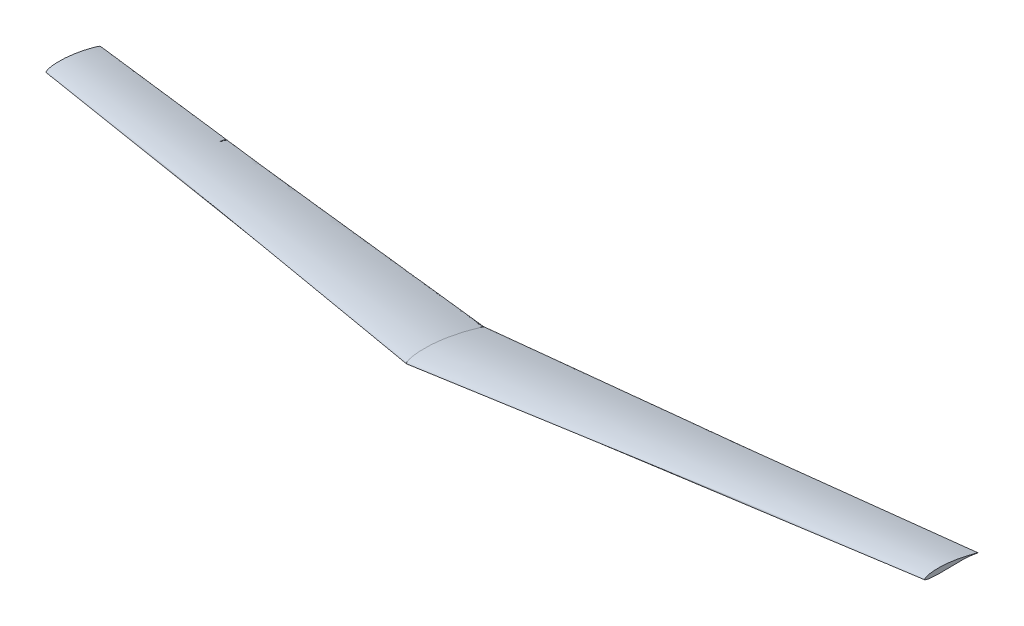
from build123d import *


with BuildPart() as part:
    # Loft3: read off the stored shape, not the designer's step
    # Loft3: loft between two sections, ruled curve by curve
    loft3_from = [
        Edge.make_bspline([(0, 75.247164627, -464.331540038), (0, 75.6060312, -457.82834533), (0, 76.2512327, -445.202547271), (0, 77.185146332, -423.396453137), (0, 77.851852326, -402.823951314), (0, 78.384441428, -378.735341731), (0, 78.599804642, -359.528542379), (0, 78.608574869, -335.434014553), (0, 78.410885776, -317.775299745), (0, 77.848540939, -293.687374761), (0, 77.266621088, -277.74828718), (0, 76.083715702, -253.682669347), (0, 75.204310786, -239.622607867), (0, 73.409020466, -216.252631889), (0, 72.250488825, -203.560310534), (0, 69.894800386, -181.715370443), (0, 68.344793791, -169.077547252), (0, 65.563444266, -149.514482666), (0, 63.445869974, -136.193461261), (0, 60.458195228, -119.791467615), (0, 57.611870491, -105.788986828), (0, 54.559453297, -92.688781018), (0, 50.729350644, -78.07194621), (0, 47.805028256, -68.371996538), (0, 43.285925655, -55.396852793), (0, 39.989169381, -47.024598313), (0, 34.755060544, -36.120807184), (0, 29.763527307, -27.033289804), (0, 25.107576593, -20.212379723), (0, 19.593769028, -13.324429015), (0, 14.717428586, -7.978729509), (0, 8.989414294, -3.614235784), (0, 4.171073763, -1.003554796), (0, 0.187452705, 0.593331348), (0, -6.337462482, -0.688665746), (0, -9.3007413, -3.958956156), (0, -12.304589132, -8.148470763), (0, -15.011270114, -13.317568851), (0, -17.604262314, -19.419368117), (0, -20.402400466, -26.642998258), (0, -22.363786989, -32.198636636), (0, -24.818935213, -39.617694728), (0, -26.916002004, -46.256885049), (0, -28.625001833, -52.042910185), (0, -30.111119868, -57.248917562), (0, -31.26278527, -61.394839145), (0, -32.884056502, -67.503030242), (0, -33.972501406, -71.786064636), (0, -35.195531482, -76.729555832), (0, -36.791182642, -83.384705035), (0, -38.493788216, -90.985953223), (0, -40.322368465, -99.597744987), (0, -42.307210197, -109.430836061), (0, -44.03457841, -118.724344416), (0, -46.262898048, -131.27758197), (0, -47.835614034, -140.702287296), (0, -50.091719165, -155.169756997), (0, -51.880886195, -167.372916857), (0, -53.845057805, -181.779612589), (0, -55.860851943, -197.387469346), (0, -57.492587754, -210.98804695), (0, -59.6109912, -229.861232229), (0, -60.933432411, -242.695021315), (0, -63.007230447, -264.184341873), (0, -64.126383253, -276.780169982), (0, -66.000951687, -299.839134327), (0, -67.012774981, -313.591861628), (0, -68.591693682, -337.634312849), (0, -69.507825803, -353.356173568), (0, -70.722564952, -377.419723199), (0, -71.478645865, -394.951250589), (0, -72.337971873, -419.030156153), (0, -72.889121706, -438.200134272), (0, -73.413599827, -462.288601341), (0, -73.728537136, -482.913185263), (0, -73.965299975, -507.006183041), (0, -74.085614533, -528.896025913), (0, -74.120515145, -552.989997208), (0, -74.05495843, -584.047648937), (0, -73.842966104, -616.256557677), (0, -73.414792031, -664.172023615), (0, -72.978245239, -705.064261293), (0, -72.439049051, -761.934735513), (0, -72.139858031, -803.384892477), (0, -72.011678844, -860.244680129), (0, -72.16207099, -901.093558595), (0, -72.848870113, -957.359853077), (0, -73.69482498, -996.457270019), (0, -75.502741586, -1051.546305771), (0, -77.119683908, -1087.795144307), (0, -80.219293997, -1141.149197232), (0, -82.553183427, -1173.512082095), (0, -87.014903347, -1224.616146322), (0, -89.848587872, -1252.180092773), (0, -95.264248106, -1297.996900966), (0, -98.478223443, -1322.318052233), (0, -104.418092524, -1361.841651034), (0, -108.335183761, -1385.753165153), (0, -113.585096912, -1414.986169203), (0, -118.176015732, -1438.625999881), (0, -122.595644632, -1459.021103053), (0, -125.8465154, -1473.886541251), (0, -127.377882012, -1480.859568216), (0, -131.642925945, -1497.670698678), (0, -128.527124068, -1486.734344721), (0, -125.812540371, -1477.386922633), (0, -122.805841688, -1467.281570547), (0, -118.71035201, -1453.210770692), (0, -114.811720143, -1439.757708319), (0, -112.34306017, -1431.253079279), (0, -110.405742131, -1424.583880294), (0, -107.378888486, -1414.167008781), (0, -104.620873392, -1404.672953379), (0, -99.890645793, -1388.348713749), (0, -94.385205618, -1369.272603864), (0, -87.718422183, -1345.970793561), (0, -79.209085893, -1315.975072113), (0, -72.735292135, -1292.819303198), (0, -62.017635352, -1253.836788849), (0, -55.530082507, -1229.702894441), (0, -43.636185572, -1184.295710226), (0, -36.627451615, -1156.744451925), (0, -24.339995571, -1106.586869976), (0, -16.755325965, -1074.373292423), (0, -4.971262664, -1021.950221986), (0, 2.719821527, -986.022006307), (0, 13.710480053, -931.830807409), (0, 21.114463837, -893.187912419), (0, 31.061196595, -837.73988643), (0, 37.793594993, -797.426206509), (0, 46.455045837, -741.26898439), (0, 52.239663992, -700.369066294), (0, 59.416683555, -644.05602025), (0, 63.985689249, -603.647055736), (0, 68.598073201, -556.130856178), (0, 71.310352704, -524.161275317), (0, 73.513229465, -493.271344733), (0, 74.605515967, -475.723985212), (0, 75.122179245, -466.596460587), (0, 75.247164627, -464.331540038)], [0, 0, 0, 0, 0.006406501, 0.01243527, 0.021468756, 0.026652485, 0.03613527, 0.040361874, 0.050352485, 0.053505235, 0.064061874, 0.06604018, 0.077205235, 0.077917643, 0.089095112, 0.08974018, 0.099529135, 0.101617643, 0.109175798, 0.112795112, 0.118014982, 0.123229135, 0.12602318, 0.132875798, 0.133187129, 0.139534913, 0.141714982, 0.145072765, 0.14972318, 0.149819578, 0.153737389, 0.15680172, 0.156887129, 0.159062281, 0.160899972, 0.163017729, 0.163234913, 0.165909021, 0.168772765, 0.169749183, 0.173519578, 0.174568397, 0.177437389, 0.180367786, 0.18050172, 0.182762281, 0.184599972, 0.186717729, 0.187108947, 0.189609021, 0.193449183, 0.194770427, 0.198268397, 0.203316152, 0.204067786, 0.210808947, 0.212714396, 0.218470427, 0.222940585, 0.227016152, 0.233950255, 0.236414396, 0.245697187, 0.246640585, 0.257650255, 0.258135474, 0.269397187, 0.271214202, 0.281835474, 0.284887791, 0.294914202, 0.299095999, 0.308587791, 0.31377818, 0.322795999, 0.328877354, 0.33747818, 0.344328147, 0.352577354, 0.368028147, 0.376010905, 0.399710905, 0.408254187, 0.431954187, 0.440484185, 0.464184185, 0.472134233, 0.495834233, 0.502649866, 0.526349866, 0.531521279, 0.555221279, 0.558268398, 0.581968398, 0.582455074, 0.603690459, 0.606155074, 0.621608427, 0.627390459, 0.635910174, 0.645308427, 0.646329529, 0.652670113, 0.6548, 0.656948054, 0.659610174, 0.663349751, 0.670029529, 0.673893203, 0.676370113, 0.6785, 0.680648054, 0.687049751, 0.688401904, 0.697593203, 0.706611667, 0.712101904, 0.728203086, 0.730311667, 0.751903086, 0.752769443, 0.776469443, 0.779869858, 0.803569858, 0.809020145, 0.832720145, 0.839709694, 0.863409694, 0.871420256, 0.895120256, 0.903610746, 0.927310746, 0.935748927, 0.959448927, 0.967307484, 0.982706501, 0.991007484, 0.997768756, 1, 1, 1, 1], 3),
    ]
    loft3_to = [
        Edge.make_bspline([(8492.832911869, -78.637931226, -1896.423668427), (8492.85012453, -78.337499617, -1891.917993478), (8492.883532504, -77.785067643, -1883.170266356), (8492.941198414, -76.937875392, -1868.061402132), (8492.995563108, -76.265679579, -1853.806412397), (8493.059176923, -75.627187523, -1837.113252347), (8493.109863102, -75.244771189, -1823.801434398), (8493.173406208, -74.923236896, -1807.09916141), (8493.21994434, -74.810501537, -1794.855897682), (8493.283389216, -74.819767162, -1778.150546507), (8493.325345648, -74.940943962, -1767.093144076), (8493.388662343, -75.294228288, -1750.391444414), (8493.425634499, -75.60792779, -1740.629519125), (8493.487062211, -76.314904494, -1724.394229982), (8493.520410083, -76.800308271, -1715.571528116), (8493.577799235, -77.819227556, -1700.372268646), (8493.610997989, -78.502979914, -1691.571475358), (8493.662396733, -79.754441715, -1677.929098828), (8493.69740518, -80.717097108, -1668.62742678), (8493.740546849, -82.077539842, -1657.149538892), (8493.777425312, -83.364045854, -1647.327172705), (8493.812013512, -84.719651468, -1638.101769545), (8493.850748153, -86.37653277, -1627.758282926), (8493.876592518, -87.602444815, -1620.846410033), (8493.911518506, -89.401030693, -1611.493314253), (8493.934278864, -90.660818051, -1605.390472432), (8493.964674223, -92.532350454, -1597.223874008), (8493.990601134, -94.242009526, -1590.247944949), (8494.011042058, -95.742389653, -1584.734742977), (8494.032747075, -97.452193951, -1578.870392987), (8494.050375213, -98.922612131, -1574.100397135), (8494.067710796, -100.556769631, -1569.393103163), (8494.080659164, -101.854574555, -1565.870355836), (8494.090562124, -102.890353394, -1563.172364784), (8494.105171066, -104.550106825, -1559.180734828), (8494.114954847, -105.760730674, -1556.498825975), (8494.126568956, -107.277063907, -1553.308259578), (8494.139723946, -109.109728474, -1549.684316212), (8494.154064465, -111.411892298, -1545.707156227), (8494.170250788, -114.313305802, -1541.191583012), (8494.181985112, -116.731879372, -1537.890429311), (8494.1964539, -120.272185221, -1533.771173748), (8494.208353383, -123.686789968, -1530.339393598), (8494.21671551, -127.052833513, -1527.843220404), (8494.222394184, -130.399175174, -1526.055302819), (8494.225747913, -133.264710698, -1524.921590173), (8494.220519533, -137.836213696, -1525.898227154), (8494.210717901, -139.937258133, -1528.295102892), (8494.198840443, -141.942988477, -1531.246866078), (8494.182060525, -144.057994724, -1535.479848449), (8494.162248016, -146.021915795, -1540.524506461), (8494.139696845, -148.049758421, -1546.284640347), (8494.113851396, -150.181790711, -1552.903016574), (8494.089331587, -152.005276777, -1559.199356561), (8494.056153634, -154.314154018, -1567.732851969), (8494.031194385, -155.90133084, -1574.165567436), (8493.992830272, -158.120189945, -1584.072413737), (8493.96043833, -159.836095738, -1592.450836702), (8493.922170729, -161.647690187, -1602.367903251), (8493.880697566, -163.450169347, -1613.129766853), (8493.844559711, -164.874980597, -1622.51992693), (8493.794423943, -166.698025841, -1635.560787489), (8493.760343388, -167.812506104, -1644.436427074), (8493.703298679, -169.546751355, -1659.304126751), (8493.669877606, -170.476512387, -1668.022290658), (8493.608726219, -172.0286061, -1683.987182746), (8493.572274143, -172.863808587, -1693.511659035), (8493.508586281, -174.18522341, -1710.16456693), (8493.466962425, -174.962772365, -1721.055776465), (8493.403292574, -176.003438399, -1737.728504636), (8493.356932576, -176.659815018, -1749.877304469), (8493.293298117, -177.420541151, -1766.565205721), (8493.242666274, -177.920137386, -1779.852465514), (8493.179083315, -178.410279455, -1796.550480228), (8493.124675324, -178.719957215, -1810.848586227), (8493.061156338, -178.953867694, -1827.552174668), (8493.003478985, -179.058003297, -1842.729060689), (8492.940033103, -179.054529441, -1859.434170027), (8492.858292065, -178.925274346, -1880.967255338), (8492.773577666, -178.635129509, -1903.297279344), (8492.64762386, -178.019998107, -1936.513750017), (8492.540197852, -177.32421509, -1964.859052283), (8492.390829771, -176.286809292, -2004.27726282), (8492.281974897, -175.510564979, -2033.005813559), (8492.132616021, -174.534903, -2072.416198685), (8492.025277895, -173.925561779, -2100.730799547), (8491.877321303, -173.313541005, -2139.740159816), (8491.774428053, -173.070750684, -2166.85239055), (8491.629285466, -173.075930987, -2205.066847053), (8491.533667072, -173.323062668, -2230.22080221), (8491.392694622, -174.099792931, -2267.269792579), (8491.307038889, -174.833242283, -2289.758109767), (8491.171597841, -176.451744851, -2325.277079239), (8491.098444408, -177.578789455, -2344.43920329), (8490.976356667, -179.903348644, -2376.380579713), (8490.911311968, -181.354210816, -2393.379406884), (8490.806183406, -184.105623897, -2420.818219029), (8490.742635674, -185.956809521, -2437.387882783), (8490.662589034, -188.608538034, -2458.231541823), (8490.59861151, -190.906657563, -2474.875264931), (8490.547875966, -192.901883164, -2488.058977844), (8490.503525265, -194.733640372, -2499.575913326), (8490.478550515, -195.802972287, -2506.058015568), (8490.450179668, -197.084470568, -2513.415721251), (8490.431426778, -197.955042419, -2518.277045572), (8490.40793798, -199.080086514, -2524.363034186), (8490.370972527, -200.925681447, -2533.93428071), (8490.332412322, -202.930840801, -2543.911452926), (8490.304894863, -204.369381672, -2551.030728773), (8490.279286198, -205.851982413, -2557.643579518), (8490.250426862, -207.610746697, -2565.088145438), (8490.29598603, -204.479012101, -2553.366763574), (8490.315265945, -203.082249868, -2548.412713348), (8490.355506237, -200.225222527, -2538.067716276), (8490.411547731, -196.309978722, -2523.654968082), (8490.474069969, -191.920486411, -2507.577381657), (8490.553557475, -186.351062771, -2487.136203545), (8490.616638575, -181.968468649, -2470.910869645), (8490.722408594, -174.69648071, -2443.698666301), (8490.787312116, -170.298483879, -2426.994850645), (8490.909557437, -162.189593809, -2395.518048032), (8490.983817537, -157.380104695, -2376.386719498), (8491.118806179, -148.919436204, -2341.585476667), (8491.205370953, -143.677828498, -2319.25222873), (8491.346125479, -135.518296765, -2282.906527749), (8491.442510562, -130.181515891, -2257.995995905), (8491.587743934, -122.554405845, -2220.424468871), (8491.691203813, -117.415711525, -2193.633868148), (8491.839494826, -110.486499029, -2155.196229849), (8491.94719067, -105.776548614, -2127.252822405), (8492.097047493, -99.703416286, -2088.328021256), (8492.206069748, -95.636659811, -2059.979107974), (8492.355991801, -90.53542312, -2020.952102344), (8492.463435111, -87.243463586, -1992.951127086), (8492.589615349, -83.836583026, -1960.026919128), (8492.674427741, -81.784291981, -1937.876030677), (8492.756287029, -80.057085918, -1916.474230313), (8492.802755817, -79.172003655, -1904.31679614), (8492.826917075, -78.742564987, -1897.992896513), (8492.832911869, -78.637931226, -1896.423668427)], [0, 0, 0, 0, 0.006406501, 0.01243527, 0.021468756, 0.026652485, 0.03613527, 0.040361874, 0.050352485, 0.053505235, 0.064061874, 0.06604018, 0.077205235, 0.077917643, 0.089095112, 0.08974018, 0.099529135, 0.101617643, 0.109175798, 0.112795112, 0.118014982, 0.123229135, 0.12602318, 0.132875798, 0.133187129, 0.139534913, 0.141714982, 0.145072765, 0.14972318, 0.149819578, 0.153737389, 0.15680172, 0.156887129, 0.159062281, 0.160899972, 0.163017729, 0.163234913, 0.165909021, 0.168772765, 0.169749183, 0.173519578, 0.174568397, 0.177437389, 0.180367786, 0.18050172, 0.182762281, 0.184599972, 0.186717729, 0.187108947, 0.189609021, 0.193449183, 0.194770427, 0.198268397, 0.203316152, 0.204067786, 0.210808947, 0.212714396, 0.218470427, 0.222940585, 0.227016152, 0.233950255, 0.236414396, 0.245697187, 0.246640585, 0.257650255, 0.258135474, 0.269397187, 0.271214202, 0.281835474, 0.284887791, 0.294914202, 0.299095999, 0.308587791, 0.31377818, 0.322795999, 0.328877354, 0.33747818, 0.344328147, 0.352577354, 0.368028147, 0.376010905, 0.399710905, 0.408254187, 0.431954187, 0.440484185, 0.464184185, 0.472134233, 0.495834233, 0.502649866, 0.526349866, 0.531521279, 0.555221279, 0.558268398, 0.581968398, 0.582455074, 0.603690459, 0.606155074, 0.621608427, 0.627390459, 0.635910174, 0.645308427, 0.646329529, 0.652670113, 0.6548, 0.656948054, 0.659610174, 0.663349751, 0.670029529, 0.673893203, 0.676370113, 0.6785, 0.680648054, 0.687049751, 0.688401904, 0.697593203, 0.706611667, 0.712101904, 0.728203086, 0.730311667, 0.751903086, 0.752769443, 0.776469443, 0.779869858, 0.803569858, 0.809020145, 0.832720145, 0.839709694, 0.863409694, 0.871420256, 0.895120256, 0.903610746, 0.927310746, 0.935748927, 0.959448927, 0.967307484, 0.982706501, 0.991007484, 0.997768756, 1, 1, 1, 1], 3),
    ]
    loft3 = Solid(Shell([*[Face.make_surface_from_curves(loft3_from[k], loft3_to[k]) for k in range(1)], Face(Wire(loft3_from)), Face(Wire(loft3_to))]))
    add(loft3)

    # Mirror2: Loft3 across plane
    add(loft3.mirror(Plane(origin=(0, 0, 0), x_dir=(0, 0, 1), z_dir=(1, 0, 0))))


solid = part.part
